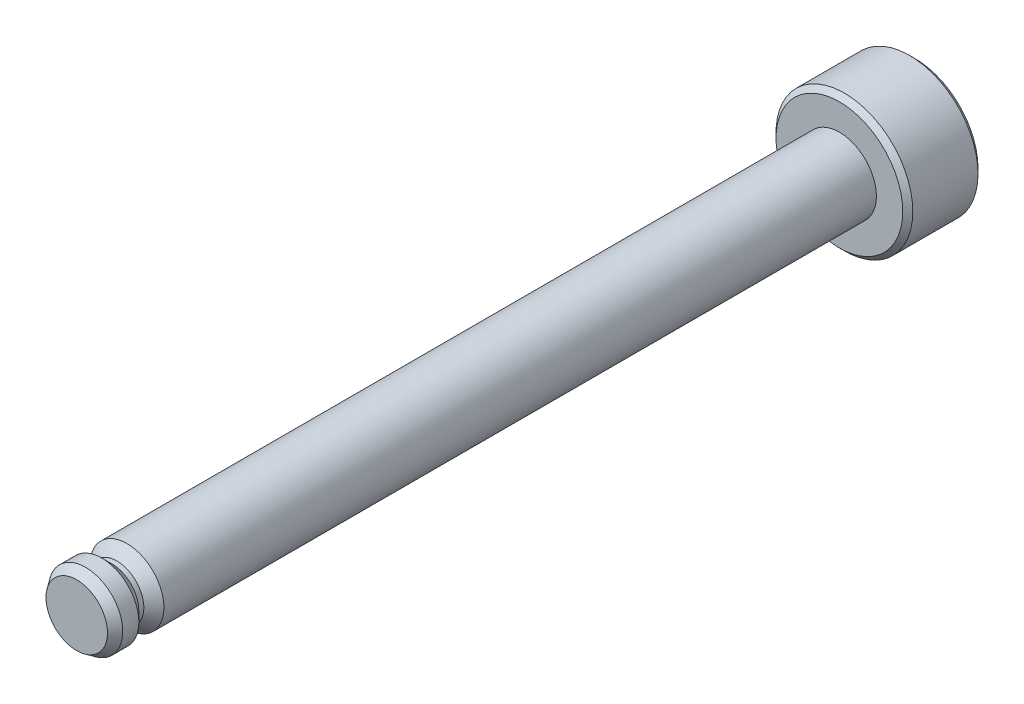
from build123d import *

# Parameters (mm, degrees)
SKETCH2_R      = 1.475
SHAFT_DEPTH    = 30.4
SKETCH5_R      = 2.725
HEAD_DEPTH     = 3
CHAMFER1_SIZE  = 0.25
CHAMFER1_SIZE2 = 0.357037002
DEBURS_SIZE    = 0.2


with BuildPart() as part:
    # Sketch2 → Shaft (new body)
    with BuildSketch(Plane.XY):
        Circle(SKETCH2_R)
    extrude(amount=SHAFT_DEPTH)

    # Sketch5 → Head (add)
    with BuildSketch(Plane.XY):
        Circle(SKETCH5_R)
    extrude(amount=-HEAD_DEPTH)

    # Chamfer1
    chamfer1_edges = [part.edges().sort_by_distance(p)[0] for p in [
        (-1.475, 0, 30.4),
    ]]
    chamfer1_side = [part.faces().sort_by_distance(p)[0] for p in [
        (0, 0, 30.4),
    ]]
    chamfer(chamfer1_edges, length=CHAMFER1_SIZE, length2=CHAMFER1_SIZE2, reference=chamfer1_side[0])

    # Deburs
    deburs_edges = [part.edges().sort_by_distance(p)[0] for p in [
        (-2.725, 0, 0),
        (-2.725, 0, -3),
    ]]
    chamfer(deburs_edges, length=DEBURS_SIZE)

    # Sketch6 → e-Clip Notch Long (revolve, cut)
    with BuildSketch(Plane(origin=(0, 0, 0), x_dir=(0, 0, -1), z_dir=(1, 0, 0))):
        Polygon((-29.4, 1.475), (-28.4, 1.475), (-28.8, 1.075), (-29, 1.075), align=None)
    revolve(axis=Axis((0, 0, 0), (0, 0, 1)), mode=Mode.SUBTRACT)


solid = part.part
